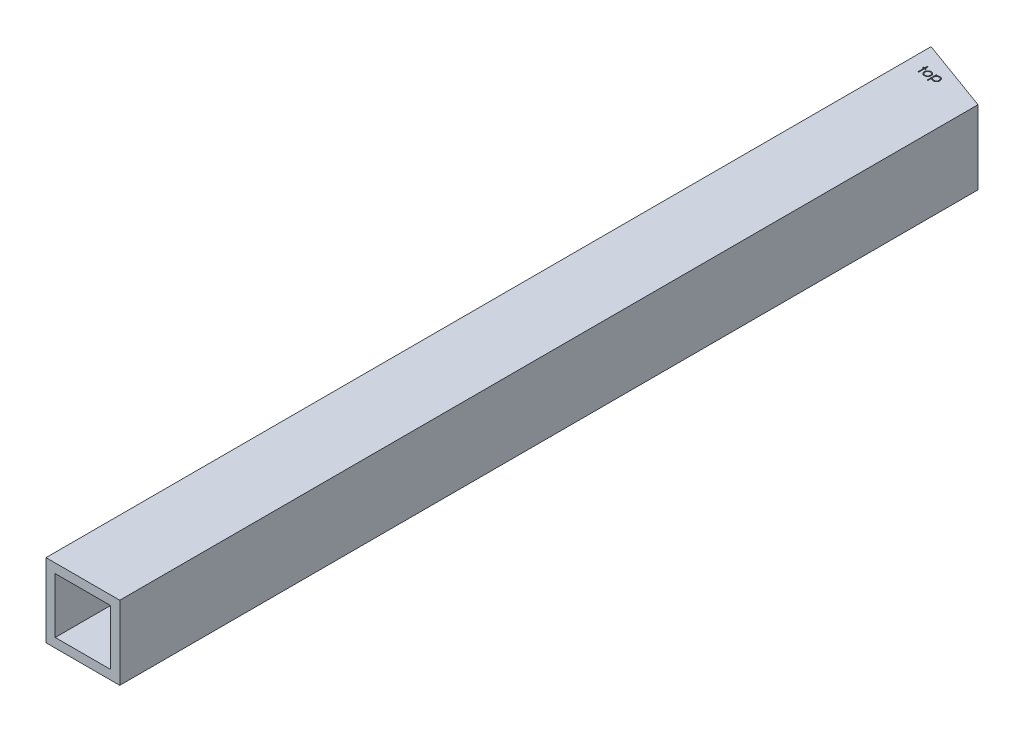
from build123d import *

# Parameters (mm, degrees)
SKETCH2_W           = 25.4
SKETCH2_H           = 25.4
SKETCH2_W_2         = 19.05
SKETCH2_H_2         = 19.05
BOSS_EXTRUDE1_DEPTH = 304.8
CUT_EXTRUDE1_DEPTH  = 307.909367729


with BuildPart() as part:
    # Sketch2 → Boss-Extrude1 (new body)
    with BuildSketch(Plane.XY):
        with Locations((12.7, 12.7)):
            Rectangle(SKETCH2_W, SKETCH2_H)
        with Locations((12.7, 12.7)):
            Rectangle(SKETCH2_W_2, SKETCH2_H_2, mode=Mode.SUBTRACT)
    extrude(amount=BOSS_EXTRUDE1_DEPTH)

    # Sketch3 → Cut-Extrude1 (cut, through all)
    # profile 1 of 4: a face of its own
    with BuildSketch(Plane(origin=(0, 25.4, 0), x_dir=(1, 0, 0), z_dir=(0, 1, 0))):
        Polygon((0, 0), (25.4, -9.24484395), (25.4, 0), align=None)
    # profile 2 of 4: a face of its own
    with BuildSketch(Plane(origin=(0, 25.4, 0), x_dir=(1, 0, 0), z_dir=(0, 1, 0))):
        Polygon((5.206442936, -6.540941157), (5.491378833, -6.540941157), (5.491378833, -7.477159106), (5.898430115, -7.477159106), (5.898430115, -7.762095003), (5.491378833, -7.762095003), (5.491378833, -9.797351414), (5.206442936, -9.797351414), (5.206442936, -7.762095003), (4.799391654, -7.762095003), (4.799391654, -7.477159106), (5.206442936, -7.477159106), align=None)
    # profile 3 of 4: a face of its own
    with BuildSketch(Plane(origin=(0, 25.4, 0), x_dir=(1, 0, 0), z_dir=(0, 1, 0))):
        with BuildLine():
            add(Edge.make_bspline(
                [(7.507554714, -7.436453978), (7.551089655, -7.437380979), (7.636451034, -7.439198602), (7.761462473, -7.458625035), (7.880792703, -7.488331573), (7.994898749, -7.529399347), (8.102319246, -7.584446545), (8.204618874, -7.650132116), (8.301517161, -7.727949183), (8.359595195, -7.788145431), (8.389075147, -7.818700572)],
                knots=[0, 0, 0, 0, 1.054011418, 2.066658804, 3.057071809, 4.030435133, 4.997543892, 5.974964718, 6.972108034, 8, 8, 8, 8], degree=3))
            add(Edge.make_bspline(
                [(8.389075147, -7.818700572), (8.414458777, -7.847923259), (8.464734793, -7.905803094), (8.529201552, -7.999652114), (8.584738253, -8.096843491), (8.629245368, -8.198667852), (8.664338211, -8.304236304), (8.689253521, -8.4139117), (8.704073455, -8.527451829), (8.706071861, -8.604562453), (8.707083961, -8.643615436)],
                knots=[0, 0, 0, 0, 1.025258237, 2.030674902, 3.01204498, 3.988269485, 4.97094183, 5.956517959, 6.965070386, 8, 8, 8, 8], degree=3))
            add(Edge.make_bspline(
                [(8.707083961, -8.643615436), (8.706193748, -8.682894774), (8.704434645, -8.760512578), (8.687794365, -8.874830145), (8.661912594, -8.985678306), (8.624872284, -9.092592978), (8.577375999, -9.195900972), (8.519418018, -9.295151063), (8.450591623, -9.390539069), (8.372573711, -9.481255023), (8.286348081, -9.564862946), (8.192807003, -9.637732162), (8.093788701, -9.700163116), (7.987976516, -9.750451865), (7.876336725, -9.790102807), (7.758628527, -9.817952108), (7.635034785, -9.834790207), (7.550645806, -9.836952448), (7.507554714, -9.838056542)],
                knots=[0, 0, 0, 0, 0.998656419, 1.973391657, 2.932242238, 3.890759089, 4.846373663, 5.82037756, 6.809684879, 7.83454468, 8.860553229, 9.859544525, 10.845671541, 11.83227036, 12.833544569, 13.85385346, 14.904124723, 16, 16, 16, 16], degree=3))
            add(Edge.make_bspline(
                [(7.507554714, -9.838056542), (7.464252505, -9.836948742), (7.379442939, -9.834779061), (7.255412941, -9.818017526), (7.137493787, -9.790115642), (7.025707844, -9.750321559), (6.919440733, -9.700161509), (6.819848696, -9.637920905), (6.72623163, -9.564841335), (6.639987758, -9.481260878), (6.561974738, -9.390537561), (6.49314708, -9.295151454), (6.435189427, -9.19590087), (6.387693057, -9.092593005), (6.350652769, -8.985678299), (6.324770992, -8.874830147), (6.308130713, -8.760512577), (6.30637161, -8.682894774), (6.305481397, -8.643615436)],
                knots=[0, 0, 0, 0, 1.099876186, 2.154163076, 3.173186993, 4.173200201, 5.163417411, 6.152872554, 7.150605724, 8.17532212, 9.198891216, 10.186952605, 11.159729845, 12.11414092, 13.071450619, 14.029093627, 15.002601286, 16, 16, 16, 16], degree=3))
            add(Edge.make_bspline(
                [(6.305481397, -8.643615436), (6.3065004, -8.604774712), (6.308517851, -8.527876754), (6.323322884, -8.414550064), (6.348141003, -8.305060289), (6.383275913, -8.199899322), (6.428193265, -8.098521176), (6.482949576, -8.001089651), (6.548073935, -7.907665003), (6.598149991, -7.849859974), (6.623490211, -7.820608625)],
                knots=[0, 0, 0, 0, 1.031353054, 2.041901799, 3.029428768, 4.008703097, 4.981709435, 5.96992636, 6.972712378, 8, 8, 8, 8], degree=3))
            add(Edge.make_bspline(
                [(6.623490211, -7.820608625), (6.652925719, -7.789788502), (6.710815824, -7.729175306), (6.808196456, -7.651585088), (6.910244422, -7.584532649), (7.018852033, -7.530579225), (7.13286434, -7.488089998), (7.252806082, -7.458548424), (7.378241728, -7.439268595), (7.464020813, -7.437401533), (7.507554714, -7.436453978)],
                knots=[0, 0, 0, 0, 1.027980169, 2.021703884, 2.998553061, 3.971491411, 4.943284454, 5.930300938, 6.949603206, 8, 8, 8, 8], degree=3))
        make_face()
        with BuildLine():
            add(Edge.make_bspline(
                [(7.506282679, -7.721389875), (7.475496418, -7.722264898), (7.414718637, -7.723992354), (7.325256585, -7.737131325), (7.239132302, -7.757947989), (7.156182394, -7.787524526), (7.076686587, -7.825714241), (7.000568772, -7.872621111), (6.927605059, -7.927623864), (6.859222758, -7.990636431), (6.796464518, -8.059469518), (6.741602354, -8.13281053), (6.694952436, -8.209469858), (6.656090292, -8.289527221), (6.627145914, -8.373793911), (6.606124672, -8.461315626), (6.592998097, -8.552270683), (6.591286882, -8.614102464), (6.590417295, -8.645523489)],
                knots=[0, 0, 0, 0, 1.021534396, 2.016698045, 2.994645724, 3.958388632, 4.93408049, 5.916473867, 6.921342795, 7.962252576, 8.998418191, 10.008913653, 10.997312074, 11.973003931, 12.956656626, 13.948281152, 14.957379055, 16, 16, 16, 16], degree=3))
            add(Edge.make_bspline(
                [(6.590417295, -8.645523489), (6.591874913, -8.686119971), (6.594768014, -8.766696396), (6.618294978, -8.885360771), (6.657652532, -8.999281451), (6.710799564, -9.107790602), (6.777389491, -9.208186168), (6.855845616, -9.2976953), (6.945325916, -9.374971001), (7.044763741, -9.439088625), (7.152128015, -9.490033546), (7.265753392, -9.526136903), (7.384263164, -9.549606224), (7.465253542, -9.551938918), (7.506282679, -9.553120644)],
                knots=[0, 0, 0, 0, 1.016792936, 2.018143844, 3.017858371, 4.030088057, 5.03801393, 6.028138512, 7.003788237, 7.991172063, 8.984598303, 9.972568034, 10.972917682, 12, 12, 12, 12], degree=3))
            add(Edge.make_bspline(
                [(7.506282679, -9.553120644), (7.547309457, -9.551932033), (7.628295176, -9.549585747), (7.746640286, -9.526255104), (7.859955104, -9.489875354), (7.967207862, -9.439145921), (8.066600424, -9.374727516), (8.15672427, -9.29813166), (8.23451051, -9.207949095), (8.301034566, -9.107657622), (8.355051968, -8.999449674), (8.394225301, -8.885339746), (8.417808826, -8.76670175), (8.420694292, -8.686121765), (8.422148064, -8.645523489)],
                knots=[0, 0, 0, 0, 1.02726834, 2.027799167, 3.010890988, 4.004497153, 4.992059811, 5.971914811, 6.958719428, 7.966827853, 8.981595046, 9.981490638, 10.983022906, 12, 12, 12, 12], degree=3))
            add(Edge.make_bspline(
                [(8.422148064, -8.645523489), (8.421278776, -8.614102276), (8.41956815, -8.552270125), (8.40643729, -8.461317757), (8.385431907, -8.373786094), (8.356429083, -8.289556063), (8.317735799, -8.209262577), (8.27018628, -8.13303561), (8.215548135, -8.059215457), (8.152032604, -7.99085894), (8.083721683, -7.9275993), (8.010728398, -7.872599783), (7.934723453, -7.825920392), (7.855458596, -7.787197874), (7.772498053, -7.758217072), (7.686494443, -7.737011128), (7.597414094, -7.724047878), (7.536854104, -7.722281543), (7.506282679, -7.721389875)],
                knots=[0, 0, 0, 0, 1.042956736, 2.052379634, 3.044323526, 4.02829302, 5.004299113, 5.996692471, 7.007513377, 8.048758398, 9.090003419, 10.095195979, 11.07790575, 12.047570684, 13.018257071, 13.989683339, 14.985167495, 16, 16, 16, 16], degree=3))
        make_face(mode=Mode.SUBTRACT)
    # profile 4 of 4: a face of its own
    with BuildSketch(Plane(origin=(0, 25.4, 0), x_dir=(1, 0, 0), z_dir=(0, 1, 0))):
        with BuildLine():
            Line((9.276955756, -7.477159106), (9.561891654, -7.477159106))
            Line((9.561891654, -7.477159106), (9.561891654, -7.906471005))
            add(Edge.make_bspline(
                [(9.561891654, -7.906471005), (9.592151657, -7.867520346), (9.650955918, -7.791827536), (9.752306367, -7.693865063), (9.85928283, -7.611246751), (9.974638211, -7.546492597), (10.096579701, -7.497669431), (10.224606875, -7.461583788), (10.359806326, -7.440319021), (10.452240965, -7.437759372), (10.499381638, -7.436453978)],
                knots=[0, 0, 0, 0, 1.0828784, 2.104357462, 3.088488658, 4.04616522, 5.001424249, 5.969181776, 6.964304535, 8, 8, 8, 8], degree=3))
            add(Edge.make_bspline(
                [(10.499381638, -7.436453978), (10.540558306, -7.437645219), (10.621946155, -7.439999769), (10.74174637, -7.45594104), (10.85711261, -7.483262089), (10.967392202, -7.52263292), (11.073766554, -7.571306096), (11.174660888, -7.632735121), (11.271646756, -7.703860737), (11.362285013, -7.785714188), (11.446033682, -7.874276973), (11.518465575, -7.969547206), (11.580942231, -8.068391838), (11.631443143, -8.172343235), (11.671002144, -8.280582823), (11.699136887, -8.393547908), (11.715880607, -8.510819654), (11.718127102, -8.590559979), (11.719263448, -8.630895083)],
                knots=[0, 0, 0, 0, 1.041296284, 2.058176809, 3.050446431, 4.034000596, 5.01514041, 6.003636468, 7.015969324, 8.052561599, 9.08815499, 10.094063707, 11.074456064, 12.040834395, 13.011057502, 13.983766392, 14.980127149, 16, 16, 16, 16], degree=3))
            add(Edge.make_bspline(
                [(11.719263448, -8.630895083), (11.718151758, -8.672081463), (11.715959344, -8.753306948), (11.698954946, -8.872584529), (11.671779781, -8.987326647), (11.632719858, -9.09734245), (11.582245079, -9.202556191), (11.520827371, -9.302891993), (11.448358933, -9.39831771), (11.365535767, -9.48753784), (11.275680604, -9.56972436), (11.179634595, -9.641604609), (11.078888284, -9.701967142), (10.973957104, -9.752388827), (10.863942775, -9.790391022), (10.749358587, -9.817802884), (10.630266926, -9.834707034), (10.549258024, -9.836931478), (10.508285884, -9.838056542)],
                knots=[0, 0, 0, 0, 1.038740735, 2.04854663, 3.033179607, 4.009277356, 4.987731542, 5.972001279, 6.972200261, 8.005528982, 9.039189865, 10.040446548, 11.026516639, 11.997840187, 12.972163198, 13.956796175, 14.96660207, 16, 16, 16, 16], degree=3))
            add(Edge.make_bspline(
                [(10.508285884, -9.838056542), (10.462178016, -9.836881966), (10.371101457, -9.834561835), (10.237934999, -9.811049227), (10.109776712, -9.775909293), (9.988046463, -9.724475206), (9.871779948, -9.658929131), (9.761634838, -9.579000587), (9.65702607, -9.484856734), (9.594062411, -9.41343573), (9.561891654, -9.376943761)],
                knots=[0, 0, 0, 0, 1.014726462, 2.004382257, 2.969841629, 3.936926163, 4.907207904, 5.903978561, 6.929055279, 8, 8, 8, 8], degree=3))
            Line((9.561891654, -9.376943761), (9.561891654, -10.652159106))
            Line((9.561891654, -10.652159106), (9.276955756, -10.652159106))
            Line((9.276955756, -10.652159106), (9.276955756, -7.477159106))
        make_face()
        with BuildLine():
            add(Edge.make_bspline(
                [(10.496837567, -7.721389875), (10.464561821, -7.721970681), (10.401019196, -7.723114137), (10.307880826, -7.736697648), (10.218168546, -7.756416885), (10.13278649, -7.78627268), (10.050916287, -7.822920175), (9.973188509, -7.868714571), (9.899657716, -7.922827462), (9.83050891, -7.984222295), (9.768040065, -8.051872191), (9.71273798, -8.124069703), (9.666285639, -8.200723401), (9.627730235, -8.281119266), (9.598390257, -8.365887489), (9.57756614, -8.454545293), (9.564475749, -8.547189718), (9.562762213, -8.610286953), (9.561891654, -8.642343401)],
                knots=[0, 0, 0, 0, 1.05670511, 2.080379991, 3.077984906, 4.06214886, 5.038337365, 6.01289324, 7.01187578, 8.025460281, 9.038092164, 10.024533457, 11.000252242, 11.969694649, 12.940728589, 13.933144304, 14.949937299, 16, 16, 16, 16], degree=3))
            add(Edge.make_bspline(
                [(9.561891654, -8.642343401), (9.563334787, -8.684424046), (9.566162009, -8.766863593), (9.589146621, -8.887317761), (9.626552896, -9.001301763), (9.679646801, -9.107855703), (9.746727815, -9.205811561), (9.827552571, -9.293523754), (9.921389742, -9.370440933), (10.026679266, -9.435230213), (10.139547913, -9.487833673), (10.257282276, -9.525492993), (10.378263275, -9.548690657), (10.460058822, -9.551635986), (10.50128969, -9.553120644)],
                knots=[0, 0, 0, 0, 1.03728447, 2.032128127, 3.01272805, 3.987917167, 4.958271349, 5.931593992, 6.91984656, 7.941419022, 8.973179163, 9.983609215, 10.983593296, 12, 12, 12, 12], degree=3))
            add(Edge.make_bspline(
                [(10.50128969, -9.553120644), (10.541689994, -9.551708788), (10.621877334, -9.548906508), (10.739949344, -9.524651152), (10.854694424, -9.487598879), (10.963715009, -9.433569853), (11.06606203, -9.367357443), (11.158483153, -9.287927985), (11.239225139, -9.195862108), (11.308044947, -9.093347251), (11.363499937, -8.983423868), (11.405165226, -8.869685037), (11.429212289, -8.752531689), (11.432620233, -8.673612335), (11.434327551, -8.634075172)],
                knots=[0, 0, 0, 0, 1.00104056, 1.986885549, 2.97790532, 3.984399681, 4.995088187, 5.994304198, 6.996462723, 8.023150851, 9.048424203, 10.043036403, 11.019596776, 12, 12, 12, 12], degree=3))
            add(Edge.make_bspline(
                [(11.434327551, -8.634075172), (11.4330079, -8.594292431), (11.430378878, -8.515036899), (11.404482637, -8.398230551), (11.365566229, -8.284032173), (11.308816231, -8.17560996), (11.24150508, -8.073307756), (11.160091733, -7.982998166), (11.068818469, -7.903921913), (10.966593298, -7.838593648), (10.856883055, -7.786627521), (10.741390239, -7.748633077), (10.620700685, -7.72579689), (10.538488456, -7.722871802), (10.496837567, -7.721389875)],
                knots=[0, 0, 0, 0, 0.983928682, 1.960191568, 2.949917689, 3.96440592, 4.982380491, 5.975291189, 6.965713506, 7.964880129, 8.970154049, 9.96478489, 10.968906225, 12, 12, 12, 12], degree=3))
        make_face(mode=Mode.SUBTRACT)
    extrude(amount=-CUT_EXTRUDE1_DEPTH, mode=Mode.SUBTRACT)


with BuildPart() as cut_extrude1_piece_1:
    # of the separate pieces the step leaves, piece 1, a body of its own (cut_extrude1_pieces)
    add(part.part.solids().sort_by_distance((0, 0, 0))[0])


with BuildPart() as cut_extrude1_piece_2:
    # of the separate pieces the step leaves, piece 2, a body of its own (cut_extrude1_pieces)
    add(part.part.solids().sort_by_distance((9.561891654, 0, 8.642343401))[0])


with BuildPart() as cut_extrude1_piece_3:
    # of the separate pieces the step leaves, piece 3, a body of its own (cut_extrude1_pieces)
    add(part.part.solids().sort_by_distance((10.496837567, 25.4, 7.721389875))[0])


with BuildPart() as cut_extrude1_piece_4:
    # of the separate pieces the step leaves, piece 4, a body of its own (cut_extrude1_pieces)
    add(part.part.solids().sort_by_distance((6.590417295, 0, 8.645523489))[0])


with BuildPart() as cut_extrude1_piece_5:
    # of the separate pieces the step leaves, piece 5, a body of its own (cut_extrude1_pieces)
    add(part.part.solids().sort_by_distance((7.506282679, 25.4, 7.721389875))[0])


solid = Compound([cut_extrude1_piece_1.part, cut_extrude1_piece_2.part, cut_extrude1_piece_3.part, cut_extrude1_piece_4.part, cut_extrude1_piece_5.part])
